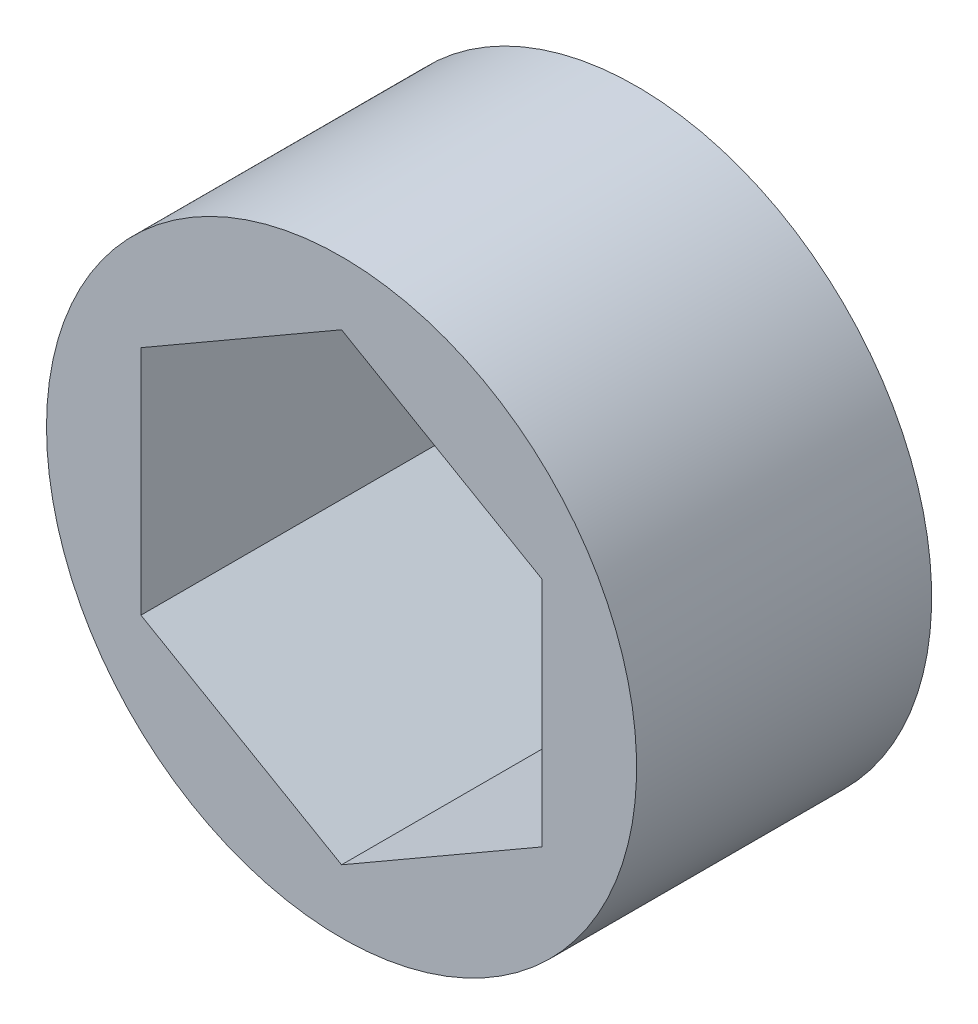
from build123d import *

# Parameters (mm, degrees)
SKETCH1_R           = 9.525
BOSS_EXTRUDE1_DEPTH = 4.7625


with BuildPart() as part:
    # Sketch1 → Boss-Extrude1 (new, symmetric)
    with BuildSketch(Plane.XY):
        Circle(SKETCH1_R)
        Polygon((0, 7.478995387), (-6.477, 3.739497694), (-6.477, -3.739497694), (0, -7.478995387), (6.477, -3.739497694), (6.477, 3.739497694), align=None, mode=Mode.SUBTRACT)
    extrude(amount=BOSS_EXTRUDE1_DEPTH, both=True)


solid = part.part
